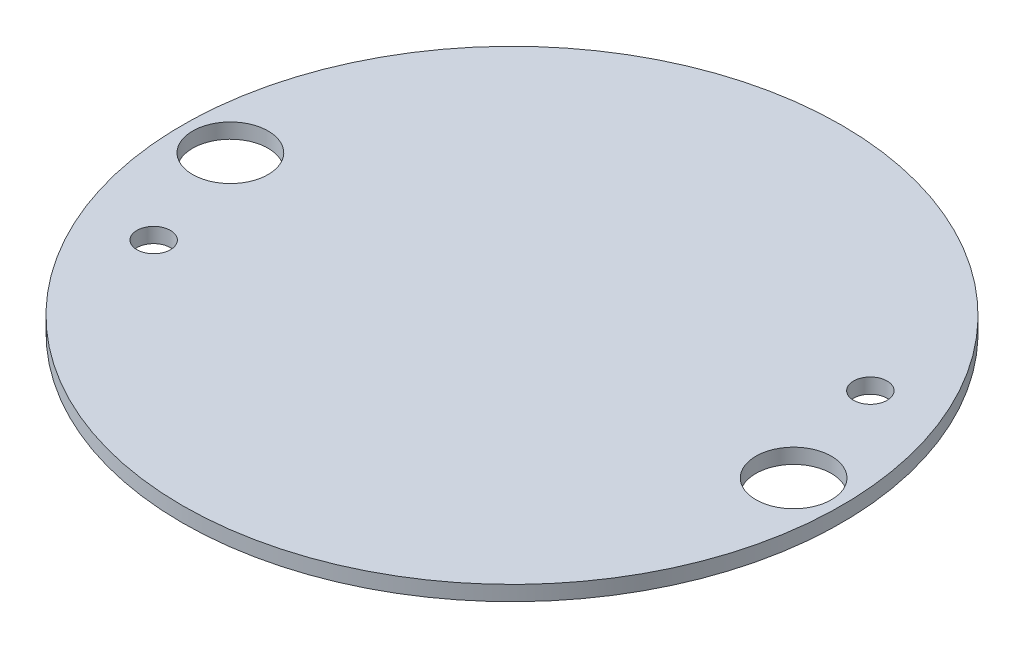
from build123d import *

# Parameters (mm, degrees)
SKETCH1_R           = 69.85
BOSS_EXTRUDE1_DEPTH = 3.175
SKETCH2_R           = 3.556
SKETCH2_R_2         = 8.001
CUT_EXTRUDE1_DEPTH  = 3.175


with BuildPart() as part:
    # Sketch1 → Boss-Extrude1 (new body)
    with BuildSketch(Plane(origin=(0, 0, 0), x_dir=(1, 0, 0), z_dir=(0, 1, 0))):
        Circle(SKETCH1_R)
    extrude(amount=BOSS_EXTRUDE1_DEPTH)

    # Sketch2 → Cut-Extrude1 (cut)
    with BuildSketch(Plane(origin=(0, 3.175, 0), x_dir=(1, 0, 0), z_dir=(0, 1, 0))):
        with Locations((-51.795490029, -24.152633658)):
            Circle(SKETCH2_R)
        with Locations((51.795490029, 24.152633658)):
            Circle(SKETCH2_R)
        with Locations((-59.69, 0)):
            Circle(SKETCH2_R_2)
        with Locations((59.69, 0)):
            Circle(SKETCH2_R_2)
    extrude(amount=-CUT_EXTRUDE1_DEPTH, mode=Mode.SUBTRACT)


solid = part.part
